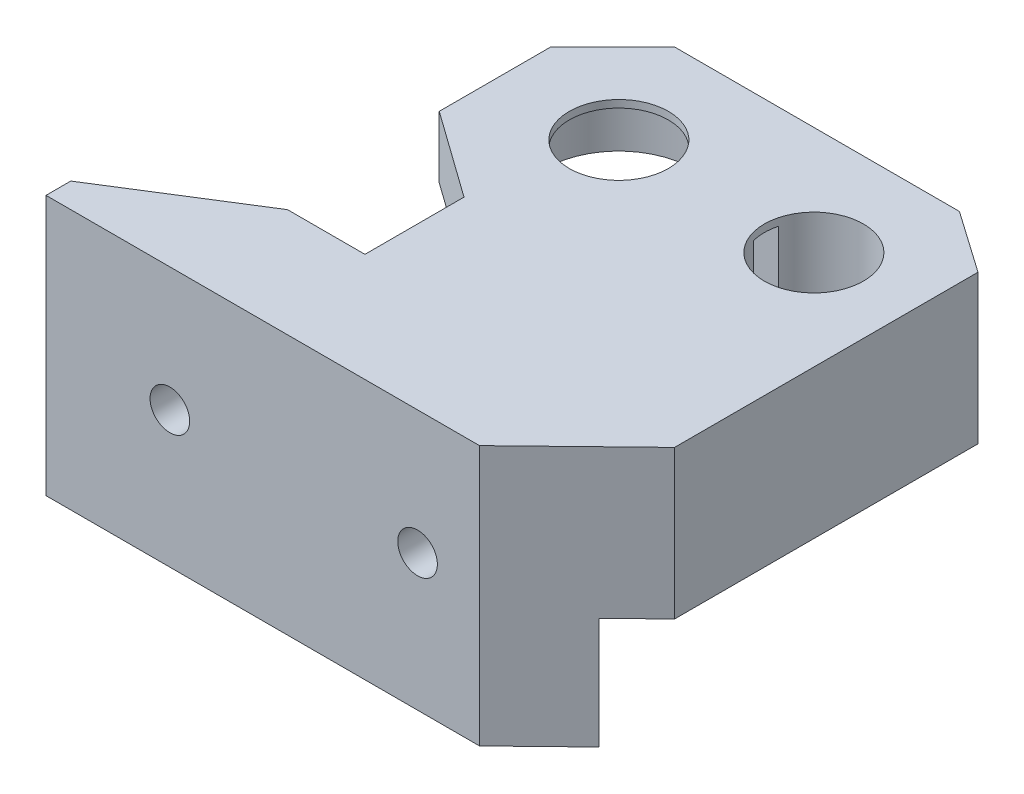
from build123d import *

# Parameters (mm, degrees)
SKETCH1_R           = 4
BOSS_EXTRUDE1_DEPTH = 5
BOSS_EXTRUDE2_DEPTH = 7
BOSS_EXTRUDE3_DEPTH = 16
BOSS_EXTRUDE4_START = 2.5
SKETCH6_R           = 7
SKETCH6_R_2         = 4
BOSS_EXTRUDE4_DEPTH = 2.5
CUT_EXTRUDE1_DEPTH  = 4.4
CUT_EXTRUDE2_DEPTH  = 42.342744224
SKETCH8_R           = 1.6
CUT_EXTRUDE3_DEPTH  = 46.805294454
SKETCH9_R           = 3
CUT_EXTRUDE4_DEPTH  = 4


with BuildPart() as part:
    # Sketch1 → Boss-Extrude1 (new body)
    with BuildSketch(Plane(origin=(0, 0, 0), x_dir=(1, 0, 0), z_dir=(0, 1, 0))):
        Polygon((-4.25, 8.75), (18.75, 8.75), (23.75, 5.25), (23.75, -19.25), (15.75, -27), (-19.25, -27), (-19.25, -25), (-8.5, -18.25), (-2.25, -18.25), (-2.25, -10.25), (-9.25, -5.25), (-9.25, 3.75), align=None)
        Circle(SKETCH1_R, mode=Mode.SUBTRACT)
        with Locations((15.75, 0)):
            Circle(SKETCH1_R, mode=Mode.SUBTRACT)
    extrude(amount=BOSS_EXTRUDE1_DEPTH)

    # Sketch2 → Boss-Extrude2 (add)
    with BuildSketch(Plane.XZ):
        Polygon((23.75, 19.25), (23.75, -5.25), (20.25, -5.25), (20.25, 18.25), (-8.5, 18.25), (-14.87037037, 22.25), (20.653225806, 22.25), align=None)
    extrude(amount=BOSS_EXTRUDE2_DEPTH)

    # Sketch3 → Boss-Extrude3 (add)
    with BuildSketch(Plane.XZ):
        Polygon((-14.87037037, 22.25), (20.653225806, 22.25), (15.75, 27), (-19.25, 27), (-19.25, 25), align=None)
    extrude(amount=BOSS_EXTRUDE3_DEPTH)

    # Sketch6 → Boss-Extrude4 (add)
    with BuildSketch(Plane.XZ.offset(BOSS_EXTRUDE4_START)):
        with Locations((15.75, 0)):
            Circle(SKETCH6_R)
        with Locations((15.75, 0)):
            Circle(SKETCH6_R_2, mode=Mode.SUBTRACT)
    extrude(amount=-BOSS_EXTRUDE4_DEPTH)

    # Sketch4 → Cut-Extrude1 (cut)
    with BuildSketch(Plane.XZ):
        with BuildLine():
            Line((5.883782294, -1), (12.395898034, -1))
            ThreePointArc((12.395898034, -1), (12.25, 0), (12.395898034, 1))
            Line((12.395898034, 1), (5.883782294, 1))
            ThreePointArc((5.883782294, 1), (-5.968156673, 0), (5.883782294, -1))
        make_face()
    extrude(amount=-CUT_EXTRUDE1_DEPTH, mode=Mode.SUBTRACT)

    # Sketch7 → Cut-Extrude2 (cut, through all)
    with BuildSketch(Plane.XZ.offset(-4.4)):
        with BuildLine():
            Line((5.883782294, -1), (11.877016654, -1))
            ThreePointArc((11.877016654, -1), (11.75, 0), (11.877016654, 1))
            Line((11.877016654, 1), (5.883782294, 1))
            ThreePointArc((5.883782294, 1), (-5.968156673, 0), (5.883782294, -1))
        make_face()
    extrude(amount=CUT_EXTRUDE2_DEPTH, mode=Mode.SUBTRACT)

    # Sketch8 → Cut-Extrude3 (cut, through all)
    with BuildSketch(Plane.XY.offset(27)):
        with Locations((10.75, -5)):
            Circle(SKETCH8_R)
        with Locations((-9.25, -5)):
            Circle(SKETCH8_R)
    extrude(amount=-CUT_EXTRUDE3_DEPTH, mode=Mode.SUBTRACT)

    # Sketch9 → Cut-Extrude4 (cut)
    with BuildSketch(Plane(origin=(0, 0, 18.25), x_dir=(-1, 0, 0), z_dir=(0, 0, -1))):
        with Locations((-10.75, -5)):
            Circle(SKETCH9_R)
        with Locations((9.25, -5)):
            Circle(SKETCH9_R)
    extrude(amount=-CUT_EXTRUDE4_DEPTH, mode=Mode.SUBTRACT)


solid = part.part
